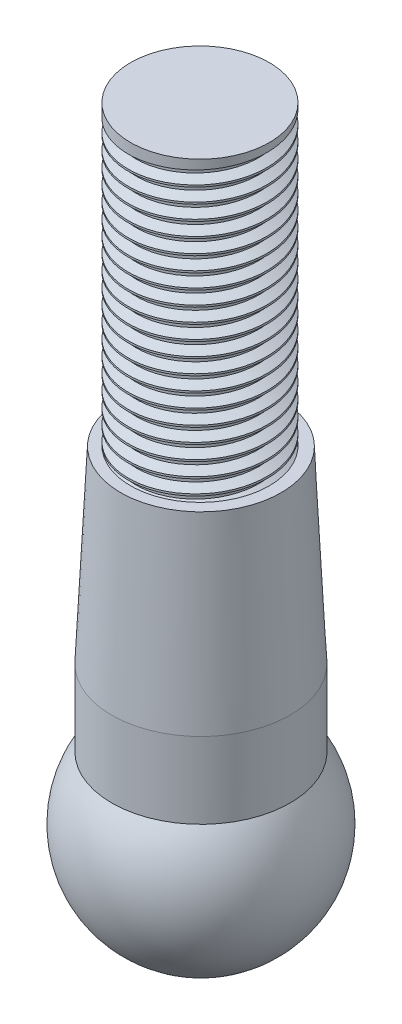
from build123d import *

# Parameters (mm, degrees)
SZKIC2_R                                = 9
DODANIE_WYCI_GNI_CIE1_DEPTH             = 3
DODANIE_WYCI_GNI_CIE1_DIRECTION_2_REACH = 28.944
SZKIC4_W                                = 7
SZKIC4_H                                = 30
GWINT1_PITCH                            = 1.5


with BuildPart() as part:
    # Szkic1 → Obrót1 (revolve)
    with BuildSketch(Plane.XY):
        with BuildLine():
            Line((0, -11), (0, 11))
            ThreePointArc((0, 11), (11, 0), (0, -11))
        make_face()
    revolve(axis=Axis((0, -11, 0), (0, 1, 0)))

    # Szkic2 → Dodanie-wyciągnięcie1 (add)
    with BuildSketch(Plane(origin=(0, 11, 0), x_dir=(1, 0, 0), z_dir=(0, 1, 0))):
        with Locations(Location((0, 0, 0), (0, 0, 270))):
            Circle(SZKIC2_R)
    extrude(amount=DODANIE_WYCI_GNI_CIE1_DEPTH)

    # Szkic2 → Dodanie-wyciągnięcie1 direction 2 (add, up to next)
    with BuildSketch(Plane(origin=(0, 11, 0), x_dir=(1, 0, 0), z_dir=(0, 1, 0)), mode=Mode.PRIVATE) as dodanie_wyci_gni_cie1_direction_2_sk1:
        with Locations(Location((0, 0, 0), (0, 0, 270))):
            Circle(SZKIC2_R)
    dodanie_wyci_gni_cie1_direction_2_tool1 = extrude(dodanie_wyci_gni_cie1_direction_2_sk1.sketch, amount=-DODANIE_WYCI_GNI_CIE1_DIRECTION_2_REACH, mode=Mode.PRIVATE) - part.part
    add(dodanie_wyci_gni_cie1_direction_2_tool1.solids().sort_by_distance((0, 11, 0))[0])

    # Szkic3 → Obrót2 (revolve)
    with BuildSketch(Plane.XY):
        Polygon((0, 33), (0, 14), (-9, 14), (-8.1, 33), align=None)
    revolve(axis=Axis((0, 33, 0), (0, -1, 0)))

    # Szkic4 → Obrót3 (revolve)
    with BuildSketch(Plane.XY, mode=Mode.PRIVATE) as obr_t3_sk:
        with Locations((-3.6, 48)):
            Rectangle(SZKIC4_W, SZKIC4_H)
    revolve(obr_t3_sk.sketch.rotate(Axis((-0.1, 33, 0), (0, 1, 0)), 180), axis=Axis((-0.1, 33, 0), (0, 1, 0)))

    # Gwint1: the profile of Profil gwintu1 profile screwed along a right-hand helix of 20 turns, 8 arcs to a turn; built about Z, then put on its axis
    gwint1_z = Axis((0, 0, 0), (0, 0, 1))
    gwint1_corners = [(7.0003, 0, -0.000173205), (7.0003, 0, 1.312673201), (6.188101188, 0, 0.843749998), (6.188101188, 0, 0.468749998)]
    with BuildLine(mode=Mode.PRIVATE) as gwint1_profile:
        Line(gwint1_corners[0], gwint1_corners[1])
        Line(gwint1_corners[1], gwint1_corners[2])
        Line(gwint1_corners[2], gwint1_corners[3])
        Line(gwint1_corners[3], gwint1_corners[0])
    gwint1_cap = Face(gwint1_profile.wire())
    gwint1_turn_angles = [0, 22.5, 45, 67.5, 90, 112.5, 135, 157.5, 180, 202.5, 225, 247.5, 270, 292.5, 315, 337.5, 360]
    gwint1_turn_weights = [1, 0.9238795325112867, 1, 0.9238795325112867, 1, 0.9238795325112867, 1, 0.9238795325112867, 1, 0.9238795325112867, 1, 0.9238795325112867, 1, 0.9238795325112867, 1, 0.9238795325112867, 1]
    gwint1_turn_rails = [Edge.make_bspline([Vector(p[0], p[1], 0).rotate(gwint1_z, gwint1_turn_angles[k]) / gwint1_turn_weights[k] + Vector(0, 0, p[2] + GWINT1_PITCH * gwint1_turn_angles[k] / 360) for k in range(17)], [0, 0, 0, 1, 1, 2, 2, 3, 3, 4, 4, 5, 5, 6, 6, 7, 7, 8, 8, 8], 2, gwint1_turn_weights) for p in gwint1_corners]
    gwint1_turn_sides = [Face.make_surface_from_curves(gwint1_turn_rails[p[0]], gwint1_turn_rails[p[1]]) for p in [(0, 1), (1, 2), (2, 3), (3, 0)]]
    gwint1 = Plane(origin=(-0.1, 63, 0), x_dir=(-1, 0, 0), z_dir=(0, -1, 0)) * Solid(Shell([*[p.moved(Location((0, 0, GWINT1_PITCH * i))) for i in range(20) for p in gwint1_turn_sides], gwint1_cap, gwint1_cap.rotate(gwint1_z, 7200).moved(Location((0, 0, GWINT1_PITCH * 7200 / 360)))]))
    add(gwint1, mode=Mode.SUBTRACT)


solid = part.part
